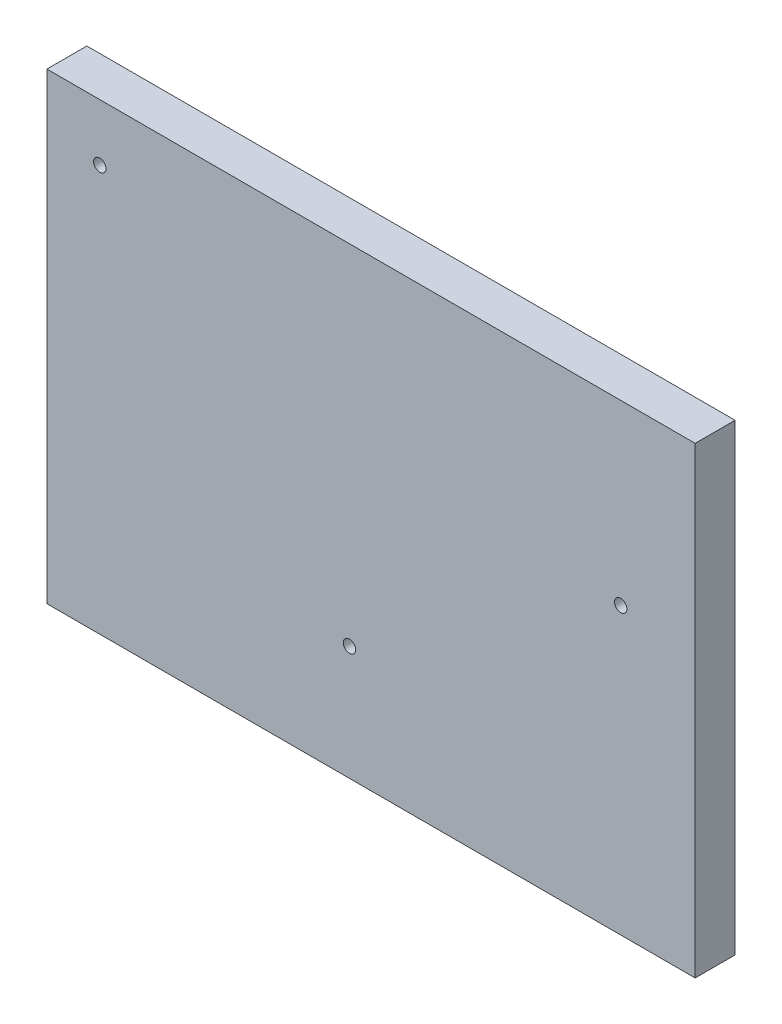
from build123d import *

# Parameters (mm, degrees)
ESQUISSE1_W                  = 210
ESQUISSE1_H                  = 150
BOSS_EXTRU_1_DEPTH           = 13
EMPREINTE1_OUTLINE_W         = 17.085
EMPREINTE1_OUTLINE_H         = 75.260341386
EMPREINTE1_OUTLINE_W_2       = 5.025
EMPREINTE1_OUTLINE_H_2       = 13.065
EMPREINTE1_DEPTH             = 6.049477858
ESQUISSE2_R                  = 2
ENL_V_MAT_EXTRU_1_DEPTH      = 30
ESQUISSE3_R                  = 2
BOSS_EXTRU_2_DEPTH           = 4
BOSS_EXTRU_2_DRAFT           = 5
BOSS_EXTRU_2_PROFILE_2_DEPTH = 4
BOSS_EXTRU_2_PROFILE_2_DRAFT = 5
BOSS_EXTRU_2_PROFILE_3_DEPTH = 4
BOSS_EXTRU_2_PROFILE_3_DRAFT = 5
BOSS_EXTRU_2_PROFILE_4_DEPTH = 4
BOSS_EXTRU_2_PROFILE_4_DRAFT = 5
EMPREINTE2_START             = -4
EMPREINTE2_OUTLINE_W         = 210
EMPREINTE2_OUTLINE_H         = 150
EMPREINTE2_OUTLINE_W_2       = 4.598902496
EMPREINTE2_OUTLINE_H_2       = 12.85735536
EMPREINTE2_OUTLINE_H_3       = 12.95785536
EMPREINTE2_OUTLINE_W_3       = 4.659202496
EMPREINTE2_OUTLINE_W_4       = 16.719202496
EMPREINTE2_OUTLINE_H_4       = 75.260341386
EMPREINTE2_DEPTH             = 4.065
ESQUISSE4_R                  = 2
BOSS_EXTRU_3_DEPTH           = 4
BOSS_EXTRU_3_DRAFT           = 5
BOSS_EXTRU_3_PROFILE_2_DEPTH = 4
BOSS_EXTRU_3_PROFILE_2_DRAFT = 5
BOSS_EXTRU_3_PROFILE_3_DEPTH = 4
BOSS_EXTRU_3_PROFILE_3_DRAFT = 5
BOSS_EXTRU_3_PROFILE_4_DEPTH = 4
BOSS_EXTRU_3_PROFILE_4_DRAFT = 5


# Read off the part's stored shape, not the designer's step: Empreinte1, Empreinte2
with BuildPart() as part:
    # Esquisse1 → Boss.-Extru.1 (new body)
    with BuildSketch(Plane.XY):
        Rectangle(ESQUISSE1_W, ESQUISSE1_H)
    extrude(amount=BOSS_EXTRU_1_DEPTH)

    # Empreinte1 outline → Empreinte1 (cut)
    with BuildSketch(Plane.XY):
        with BuildLine():
            Line((-92.295579376, -67.627741397), (96.644420624, -67.627741397))
            ThreePointArc((96.644420624, -67.627741397), (97.355062939, -67.333383712), (97.649420624, -66.622741397))
            Line((97.649420624, -66.622741397), (97.649420624, 62.017258603))
            ThreePointArc((97.649420624, 62.017258603), (97.35506294, 62.727900918), (96.644420624, 63.022258603))
            Line((96.644420624, 63.022258603), (-92.295579376, 63.022258603))
            ThreePointArc((-92.295579376, 63.022258603), (-93.006221692, 62.727900918), (-93.300579376, 62.017258603))
            Line((-93.300579376, 62.017258603), (-93.300579376, -66.622741397))
            ThreePointArc((-93.300579376, -66.622741397), (-93.006221691, -67.333383712), (-92.295579376, -67.627741397))
        make_face()
        with BuildLine():
            Line((-13.725749511, -60.711247466), (-79.085208702, -60.711247466))
            ThreePointArc((-79.085208702, -60.711247466), (-80.151172175, -60.269710939), (-80.592708702, -59.203747466))
            Line((-80.592708702, -59.203747466), (-80.592708702, 53.673832534))
            ThreePointArc((-80.592708702, 53.673832534), (-80.151172175, 54.739796007), (-79.085208702, 55.181332534))
            Line((-79.085208702, 55.181332534), (-13.725749511, 55.181332534))
            ThreePointArc((-13.725749511, 55.181332534), (-12.659786038, 54.739796007), (-12.218249511, 53.673832534))
            Line((-12.218249511, 53.673832534), (-12.218249511, -59.203747466))
            ThreePointArc((-12.218249511, -59.203747466), (-12.659786038, -60.269710939), (-13.725749511, -60.711247466))
        make_face(mode=Mode.SUBTRACT)
        with BuildLine():
            Line((66.674250489, -60.711247466), (1.314791298, -60.711247466))
            ThreePointArc((1.314791298, -60.711247466), (0.248827825, -60.269710939), (-0.192708702, -59.203747466))
            Line((-0.192708702, -59.203747466), (-0.192708702, 53.673832534))
            ThreePointArc((-0.192708702, 53.673832534), (0.248827825, 54.739796007), (1.314791298, 55.181332534))
            Line((1.314791298, 55.181332534), (66.674250489, 55.181332534))
            ThreePointArc((66.674250489, 55.181332534), (67.740213962, 54.739796007), (68.181750489, 53.673832534))
            Line((68.181750489, 53.673832534), (68.181750489, -59.203747466))
            ThreePointArc((68.181750489, -59.203747466), (67.740213962, -60.269710939), (66.674250489, -60.711247466))
        make_face(mode=Mode.SUBTRACT)
        with Locations((81.702000923, -23.081076773)):
            Rectangle(EMPREINTE1_OUTLINE_W, EMPREINTE1_OUTLINE_H, mode=Mode.SUBTRACT)
        with Locations((75.672000923, 27.96142794)):
            Rectangle(EMPREINTE1_OUTLINE_W_2, EMPREINTE1_OUTLINE_H_2, mode=Mode.SUBTRACT)
        with Locations((87.732000923, 27.96142794)):
            Rectangle(EMPREINTE1_OUTLINE_W_2, EMPREINTE1_OUTLINE_H_2, mode=Mode.SUBTRACT)
        with Locations((75.672000923, 48.06142794)):
            Rectangle(EMPREINTE1_OUTLINE_W_2, EMPREINTE1_OUTLINE_H_2, mode=Mode.SUBTRACT)
        with Locations((87.732000923, 48.06142794)):
            Rectangle(EMPREINTE1_OUTLINE_W_2, EMPREINTE1_OUTLINE_H_2, mode=Mode.SUBTRACT)
    extrude(amount=EMPREINTE1_DEPTH, mode=Mode.SUBTRACT)

    # Esquisse2 → Enlèv. mat.-Extru.1 (cut)
    with BuildSketch(Plane.XY.offset(13)):
        with Locations((-87.86916098, 56.604294197)):
            Circle(ESQUISSE2_R)
        with Locations((80.881593918, 17.452530083)):
            Circle(ESQUISSE2_R)
        with Locations((-6.991449763, -37.908053034)):
            Circle(ESQUISSE2_R)
    extrude(amount=-ENL_V_MAT_EXTRU_1_DEPTH, mode=Mode.SUBTRACT)


with BuildPart() as boss_extru_2_tool:
    # Esquisse3 → Boss.-Extru.2 (with draft: the straight prism first)
    with BuildSketch(Plane(origin=(0, 0, 0), x_dir=(-1, 0, 0), z_dir=(0, 0, -1))):
        with Locations((-100.155653932, 68.889368264)):
            Circle(ESQUISSE3_R)
    extrude(amount=BOSS_EXTRU_2_DEPTH)
    # Boss.-Extru.2: the draft: its side faces are tilted about the plane it starts from
    boss_extru_2_sides = [boss_extru_2_tool.faces().sort_by_distance(p)[0] for p in [
        (102.155653932, 68.889368264, -2),
    ]]
    draft(boss_extru_2_sides, Plane(origin=(0, 0, 0), x_dir=(-1, 0, 0), z_dir=(0, 0, -1)), BOSS_EXTRU_2_DRAFT)


with BuildPart() as part_1:
    add(part.part)

    # Boss.-Extru.2: add boss_extru_2_tool
    add(boss_extru_2_tool.part)


with BuildPart() as boss_extru_2_profile_2_tool:
    # Esquisse3 → Boss.-Extru.2 profile 2 (with draft: the straight prism first)
    with BuildSketch(Plane(origin=(0, 0, 0), x_dir=(-1, 0, 0), z_dir=(0, 0, -1))):
        with Locations((98.736763649, 70.889368264)):
            Circle(ESQUISSE3_R)
    extrude(amount=BOSS_EXTRU_2_PROFILE_2_DEPTH)
    # Boss.-Extru.2 profile 2: the draft: its side faces are tilted about the plane it starts from
    boss_extru_2_profile_2_sides = [boss_extru_2_profile_2_tool.faces().sort_by_distance(p)[0] for p in [
        (-96.736763649, 70.889368264, -2),
    ]]
    draft(boss_extru_2_profile_2_sides, Plane(origin=(0, 0, 0), x_dir=(-1, 0, 0), z_dir=(0, 0, -1)), BOSS_EXTRU_2_PROFILE_2_DRAFT)


with BuildPart() as part_2:
    add(part_1.part)

    # Boss.-Extru.2 profile 2: add boss_extru_2_profile_2_tool
    add(boss_extru_2_profile_2_tool.part)


with BuildPart() as boss_extru_2_profile_3_tool:
    # Esquisse3 → Boss.-Extru.2 profile 3 (with draft: the straight prism first)
    with BuildSketch(Plane(origin=(0, 0, 0), x_dir=(-1, 0, 0), z_dir=(0, 0, -1))):
        with Locations((98.736763649, -70.420119621)):
            Circle(ESQUISSE3_R)
    extrude(amount=BOSS_EXTRU_2_PROFILE_3_DEPTH)
    # Boss.-Extru.2 profile 3: the draft: its side faces are tilted about the plane it starts from
    boss_extru_2_profile_3_sides = [boss_extru_2_profile_3_tool.faces().sort_by_distance(p)[0] for p in [
        (-96.736763649, -70.420119621, -2),
    ]]
    draft(boss_extru_2_profile_3_sides, Plane(origin=(0, 0, 0), x_dir=(-1, 0, 0), z_dir=(0, 0, -1)), BOSS_EXTRU_2_PROFILE_3_DRAFT)


with BuildPart() as part_3:
    add(part_2.part)

    # Boss.-Extru.2 profile 3: add boss_extru_2_profile_3_tool
    add(boss_extru_2_profile_3_tool.part)


with BuildPart() as boss_extru_2_profile_4_tool:
    # Esquisse3 → Boss.-Extru.2 profile 4 (with draft: the straight prism first)
    with BuildSketch(Plane(origin=(0, 0, 0), x_dir=(-1, 0, 0), z_dir=(0, 0, -1))):
        with Locations((-36.278038097, -50.689996009)):
            Circle(ESQUISSE3_R)
    extrude(amount=BOSS_EXTRU_2_PROFILE_4_DEPTH)
    # Boss.-Extru.2 profile 4: the draft: its side faces are tilted about the plane it starts from
    boss_extru_2_profile_4_sides = [boss_extru_2_profile_4_tool.faces().sort_by_distance(p)[0] for p in [
        (38.278038097, -50.689996009, -2),
    ]]
    draft(boss_extru_2_profile_4_sides, Plane(origin=(0, 0, 0), x_dir=(-1, 0, 0), z_dir=(0, 0, -1)), BOSS_EXTRU_2_PROFILE_4_DRAFT)


with BuildPart() as part_4:
    add(part_3.part)

    # Boss.-Extru.2 profile 4: add boss_extru_2_profile_4_tool
    add(boss_extru_2_profile_4_tool.part)

    # Empreinte2 outline → Empreinte2 (cut)
    # profile 1 of 8: a face of its own
    with BuildSketch(Plane.XY.offset(EMPREINTE2_START)):
        Rectangle(EMPREINTE2_OUTLINE_W, EMPREINTE2_OUTLINE_H)
        with BuildLine():
            ThreePointArc((98.137667727, -66.955855104), (97.841838253, -67.67005063), (97.127642727, -67.965880104))
            Line((97.127642727, -67.965880104), (-92.757057273, -67.965880104))
            ThreePointArc((-92.757057273, -67.965880104), (-93.4712528, -67.670050631), (-93.767082273, -66.955855104))
            Line((-93.767082273, -66.955855104), (-93.767082273, 62.327344896))
            ThreePointArc((-93.767082273, 62.327344896), (-93.4712528, 63.041540423), (-92.757057273, 63.337369896))
            Line((-92.757057273, 63.337369896), (97.127642727, 63.337369896))
            ThreePointArc((97.127642727, 63.337369896), (97.841838254, 63.041540423), (98.137667727, 62.327344896))
            Line((98.137667727, 62.327344896), (98.137667727, -66.955855104))
        make_face(mode=Mode.SUBTRACT)
    # profile 2 of 8: a face of its own
    with BuildSketch(Plane.XY.offset(EMPREINTE2_START)):
        with BuildLine():
            ThreePointArc((-12.287286036, -59.654723166), (-12.281328382, -59.577346464), (-12.279340759, -59.499766203))
            Line((-12.279340759, -59.499766203), (-12.279340759, 53.942201697))
            ThreePointArc((-12.279340759, 53.942201697), (-12.282615306, 54.041757722), (-12.292424794, 54.140883394))
            ThreePointArc((-12.292424794, 54.140883394), (-12.840177075, 54.893798809), (-13.725749511, 55.181332534))
            Line((-13.725749511, 55.181332534), (-79.085208702, 55.181332534))
            ThreePointArc((-79.085208702, 55.181332534), (-80.151172175, 54.739796007), (-80.592708702, 53.673832534))
            Line((-80.592708702, 53.673832534), (-80.592708702, -59.203747466))
            ThreePointArc((-80.592708702, -59.203747466), (-80.151172175, -60.269710939), (-79.085208702, -60.711247466))
            Line((-79.085208702, -60.711247466), (-13.725749511, -60.711247466))
            ThreePointArc((-13.725749511, -60.711247466), (-12.833362156, -60.418737614), (-12.287286036, -59.654723166))
        make_face()
    # profile 3 of 8: a face of its own
    with BuildSketch(Plane.XY.offset(EMPREINTE2_START)):
        with Locations((87.945049675, 48.16525026)):
            Rectangle(EMPREINTE2_OUTLINE_W_2, EMPREINTE2_OUTLINE_H_2)
    # profile 4 of 8: a face of its own
    with BuildSketch(Plane.XY.offset(EMPREINTE2_START)):
        with Locations((87.945049675, 28.01500026)):
            Rectangle(EMPREINTE2_OUTLINE_W_2, EMPREINTE2_OUTLINE_H_3)
    # profile 5 of 8: a face of its own
    with BuildSketch(Plane.XY.offset(EMPREINTE2_START)):
        with Locations((75.854899675, 48.16525026)):
            Rectangle(EMPREINTE2_OUTLINE_W_3, EMPREINTE2_OUTLINE_H_2)
    # profile 6 of 8: a face of its own
    with BuildSketch(Plane.XY.offset(EMPREINTE2_START)):
        with Locations((75.854899675, 28.01500026)):
            Rectangle(EMPREINTE2_OUTLINE_W_3, EMPREINTE2_OUTLINE_H_3)
    # profile 7 of 8: a face of its own
    with BuildSketch(Plane.XY.offset(EMPREINTE2_START)):
        with Locations((81.884899675, -23.081076773)):
            Rectangle(EMPREINTE2_OUTLINE_W_4, EMPREINTE2_OUTLINE_H_4)
    # profile 8 of 8: a face of its own
    with BuildSketch(Plane.XY.offset(EMPREINTE2_START)):
        with BuildLine():
            ThreePointArc((-0.192708702, -59.203747466), (0.248827825, -60.269710939), (1.314791298, -60.711247466))
            Line((1.314791298, -60.711247466), (66.674250489, -60.711247466))
            ThreePointArc((66.674250489, -60.711247466), (67.740213962, -60.269710939), (68.181750489, -59.203747466))
            Line((68.181750489, -59.203747466), (68.181750489, 53.673832534))
            ThreePointArc((68.181750489, 53.673832534), (67.740213962, 54.739796007), (66.674250489, 55.181332534))
            Line((66.674250489, 55.181332534), (1.314791298, 55.181332534))
            ThreePointArc((1.314791298, 55.181332534), (0.248827825, 54.739796007), (-0.192708702, 53.673832534))
            Line((-0.192708702, 53.673832534), (-0.192708702, -59.203747466))
        make_face()
    extrude(amount=EMPREINTE2_DEPTH, mode=Mode.SUBTRACT)


with BuildPart() as boss_extru_3_tool:
    # Esquisse4 → Boss.-Extru.3 (with draft: the straight prism first)
    with BuildSketch(Plane(origin=(0, 0, 0.065), x_dir=(-1, 0, 0), z_dir=(0, 0, -1))):
        with Locations((-97.25417956, 68.831486837)):
            Circle(ESQUISSE4_R)
    extrude(amount=BOSS_EXTRU_3_DEPTH)
    # Boss.-Extru.3: the draft: its side faces are tilted about the plane it starts from
    boss_extru_3_sides = [boss_extru_3_tool.faces().sort_by_distance(p)[0] for p in [
        (99.25417956, 68.831486837, -1.935),
    ]]
    draft(boss_extru_3_sides, Plane(origin=(0, 0, 0.065), x_dir=(-1, 0, 0), z_dir=(0, 0, -1)), BOSS_EXTRU_3_DRAFT)


with BuildPart() as part_5:
    add(part_4.part)

    # Boss.-Extru.3: add boss_extru_3_tool
    add(boss_extru_3_tool.part)


with BuildPart() as boss_extru_3_profile_2_tool:
    # Esquisse4 → Boss.-Extru.3 profile 2 (with draft: the straight prism first)
    with BuildSketch(Plane(origin=(0, 0, 0.065), x_dir=(-1, 0, 0), z_dir=(0, 0, -1))):
        with Locations((98.056714057, 68.831486837)):
            Circle(ESQUISSE4_R)
    extrude(amount=BOSS_EXTRU_3_PROFILE_2_DEPTH)
    # Boss.-Extru.3 profile 2: the draft: its side faces are tilted about the plane it starts from
    boss_extru_3_profile_2_sides = [boss_extru_3_profile_2_tool.faces().sort_by_distance(p)[0] for p in [
        (-96.056714057, 68.831486837, -1.935),
    ]]
    draft(boss_extru_3_profile_2_sides, Plane(origin=(0, 0, 0.065), x_dir=(-1, 0, 0), z_dir=(0, 0, -1)), BOSS_EXTRU_3_PROFILE_2_DRAFT)


with BuildPart() as part_6:
    add(part_5.part)

    # Boss.-Extru.3 profile 2: add boss_extru_3_profile_2_tool
    add(boss_extru_3_profile_2_tool.part)


with BuildPart() as boss_extru_3_profile_3_tool:
    # Esquisse4 → Boss.-Extru.3 profile 3 (with draft: the straight prism first)
    with BuildSketch(Plane(origin=(0, 0, 0.065), x_dir=(-1, 0, 0), z_dir=(0, 0, -1))):
        with Locations((-99.25417956, -70.832982535)):
            Circle(ESQUISSE4_R)
    extrude(amount=BOSS_EXTRU_3_PROFILE_3_DEPTH)
    # Boss.-Extru.3 profile 3: the draft: its side faces are tilted about the plane it starts from
    boss_extru_3_profile_3_sides = [boss_extru_3_profile_3_tool.faces().sort_by_distance(p)[0] for p in [
        (101.25417956, -70.832982535, -1.935),
    ]]
    draft(boss_extru_3_profile_3_sides, Plane(origin=(0, 0, 0.065), x_dir=(-1, 0, 0), z_dir=(0, 0, -1)), BOSS_EXTRU_3_PROFILE_3_DRAFT)


with BuildPart() as part_7:
    add(part_6.part)

    # Boss.-Extru.3 profile 3: add boss_extru_3_profile_3_tool
    add(boss_extru_3_profile_3_tool.part)


with BuildPart() as boss_extru_3_profile_4_tool:
    # Esquisse4 → Boss.-Extru.3 profile 4 (with draft: the straight prism first)
    with BuildSketch(Plane(origin=(0, 0, 0.065), x_dir=(-1, 0, 0), z_dir=(0, 0, -1))):
        with Locations((98.056714057, -70.832982535)):
            Circle(ESQUISSE4_R)
    extrude(amount=BOSS_EXTRU_3_PROFILE_4_DEPTH)
    # Boss.-Extru.3 profile 4: the draft: its side faces are tilted about the plane it starts from
    boss_extru_3_profile_4_sides = [boss_extru_3_profile_4_tool.faces().sort_by_distance(p)[0] for p in [
        (-96.056714057, -70.832982535, -1.935),
    ]]
    draft(boss_extru_3_profile_4_sides, Plane(origin=(0, 0, 0.065), x_dir=(-1, 0, 0), z_dir=(0, 0, -1)), BOSS_EXTRU_3_PROFILE_4_DRAFT)


with BuildPart() as part_8:
    add(part_7.part)

    # Boss.-Extru.3 profile 4: add boss_extru_3_profile_4_tool
    add(boss_extru_3_profile_4_tool.part)


solid = part_8.part
